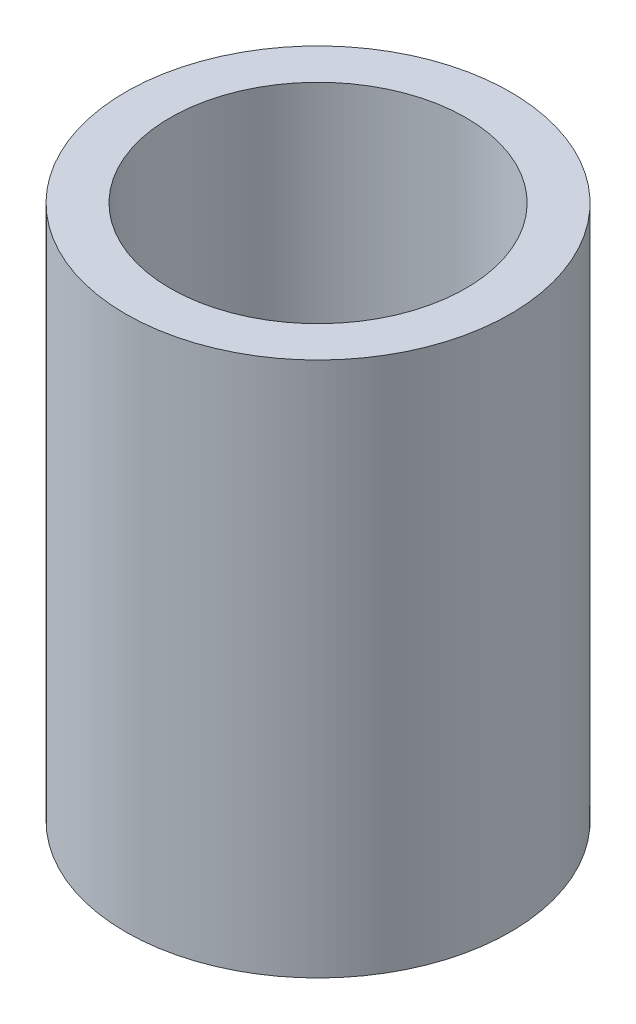
from build123d import *

# Parameters (mm, degrees)
SKETCH1_R           = 35
BOSS_EXTRUDE1_DEPTH = 97.380978559
SKETCH2_R           = 26.903583282
CUT_EXTRUDE1_DEPTH  = 110.238523356


with BuildPart() as part:
    # Sketch1 → Boss-Extrude1 (new body)
    with BuildSketch(Plane(origin=(0, 0, 0), x_dir=(1, 0, 0), z_dir=(0, 1, 0))):
        Circle(SKETCH1_R)
    extrude(amount=BOSS_EXTRUDE1_DEPTH)

    # Sketch2 → Cut-Extrude1 (cut, through all)
    with BuildSketch(Plane(origin=(0, 0, 0), x_dir=(1, 0, 0), z_dir=(0, 1, 0))):
        Circle(SKETCH2_R)
    extrude(amount=CUT_EXTRUDE1_DEPTH, mode=Mode.SUBTRACT)


solid = part.part
